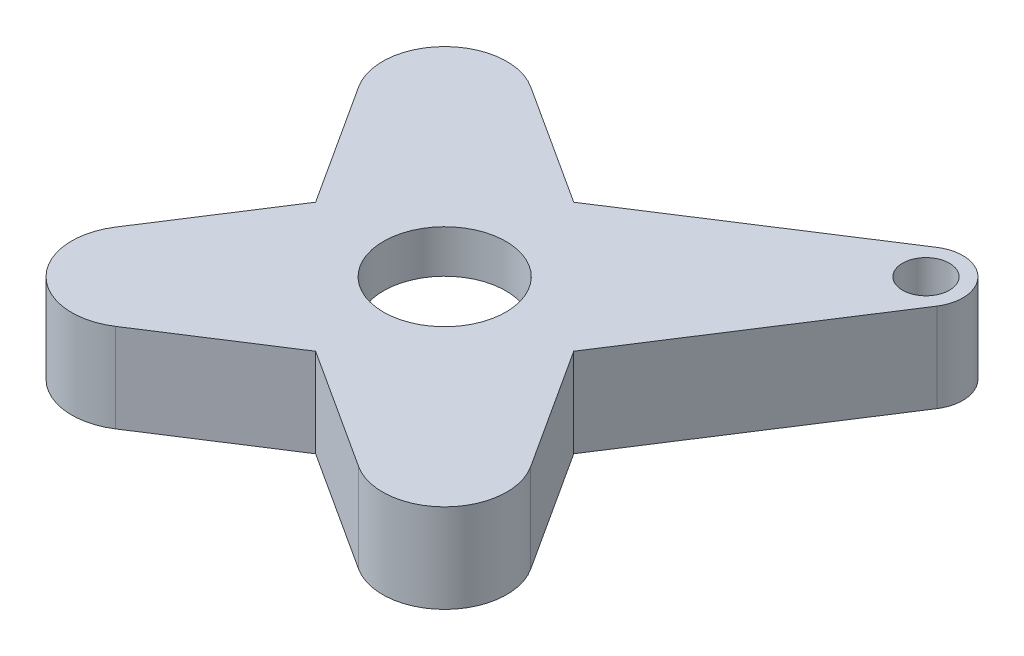
from build123d import *

# Parameters (mm, degrees)
SKETCH1_R           = 4.572
SKETCH1_R_2         = 1.75
BOSS_EXTRUDE1_DEPTH = 3.2004
BOSS_EXTRUDE2_START = -3.429
SKETCH1_3_R         = 1.75
BOSS_EXTRUDE2_DEPTH = 3.429


with BuildPart() as part:
    # Sketch1 → Boss-Extrude1 (new body)
    with BuildSketch(Plane(origin=(0, 0, 0), x_dir=(1, 0, 0), z_dir=(0, 1, 0))):
        with BuildLine():
            Line((15.494618326, -9.079673628), (9.632116129, 0))
            Line((9.632116129, 0), (20.267125172, 16.471194022))
            ThreePointArc((20.267125172, 16.471194022), (19.901971998, 19.901971998), (16.471194022, 20.267125172))
            Line((16.471194022, 20.267125172), (0, 9.632116129))
            Line((0, 9.632116129), (-9.079673628, 15.494618326))
            ThreePointArc((-9.079673628, 15.494618326), (-14.877526676, 14.877526676), (-15.494618326, 9.079673628))
            Line((-15.494618326, 9.079673628), (-9.632116129, 0))
            Line((-9.632116129, 0), (-15.494618326, -9.079673628))
            ThreePointArc((-15.494618326, -9.079673628), (-14.877526676, -14.877526676), (-9.079673628, -15.494618326))
            Line((-9.079673628, -15.494618326), (0, -9.632116129))
            Line((0, -9.632116129), (9.079673628, -15.494618326))
            ThreePointArc((9.079673628, -15.494618326), (14.877526676, -14.877526676), (15.494618326, -9.079673628))
        make_face()
        Circle(SKETCH1_R, mode=Mode.SUBTRACT)
        with Locations((17.960512242, 17.960512242)):
            Circle(SKETCH1_R_2, mode=Mode.SUBTRACT)
    extrude(amount=BOSS_EXTRUDE1_DEPTH)

    # Sketch1<3> → Boss-Extrude2 (add)
    with BuildSketch(Plane(origin=(0, 0, 0), x_dir=(1, 0, 0), z_dir=(0, 1, 0)).offset(BOSS_EXTRUDE2_START)):
        with BuildLine():
            Line((15.494618326, -9.079673628), (9.632116129, 0))
            Line((9.632116129, 0), (20.267125172, 16.471194022))
            ThreePointArc((20.267125172, 16.471194022), (19.901971998, 19.901971998), (16.471194022, 20.267125172))
            Line((16.471194022, 20.267125172), (0, 9.632116129))
            Line((0, 9.632116129), (-9.079673628, 15.494618326))
            ThreePointArc((-9.079673628, 15.494618326), (-14.877526676, 14.877526676), (-15.494618326, 9.079673628))
            Line((-15.494618326, 9.079673628), (-9.632116129, 0))
            Line((-9.632116129, 0), (-15.494618326, -9.079673628))
            ThreePointArc((-15.494618326, -9.079673628), (-14.877526676, -14.877526676), (-9.079673628, -15.494618326))
            Line((-9.079673628, -15.494618326), (0, -9.632116129))
            Line((0, -9.632116129), (9.079673628, -15.494618326))
            ThreePointArc((9.079673628, -15.494618326), (14.877526676, -14.877526676), (15.494618326, -9.079673628))
        make_face()
        with BuildLine():
            Line((13.360762621, 10.457447133), (7.57, 1.488881682))
            ThreePointArc((7.57, 1.488881682), (6.773645479, 0), (7.57, -1.488881682))
            Line((7.57, -1.488881682), (13.360762621, -10.457447133))
            ThreePointArc((13.360762621, -10.457447133), (13.081475452, -13.081475452), (10.457447133, -13.360762621))
            Line((10.457447133, -13.360762621), (1.488881682, -7.57))
            ThreePointArc((1.488881682, -7.57), (0, -6.773645479), (-1.488881682, -7.57))
            Line((-1.488881682, -7.57), (-10.457447133, -13.360762621))
            ThreePointArc((-10.457447133, -13.360762621), (-13.081475452, -13.081475452), (-13.360762621, -10.457447133))
            Line((-13.360762621, -10.457447133), (-7.57, -1.488881682))
            ThreePointArc((-7.57, -1.488881682), (-6.773645479, 0), (-7.57, 1.488881682))
            Line((-7.57, 1.488881682), (-13.360762621, 10.457447133))
            ThreePointArc((-13.360762621, 10.457447133), (-13.081475452, 13.081475452), (-10.457447133, 13.360762621))
            Line((-10.457447133, 13.360762621), (-1.488881682, 7.57))
            ThreePointArc((-1.488881682, 7.57), (0, 6.773645479), (1.488881682, 7.57))
            Line((1.488881682, 7.57), (10.457447133, 13.360762621))
            ThreePointArc((10.457447133, 13.360762621), (13.081475452, 13.081475452), (13.360762621, 10.457447133))
        make_face(mode=Mode.SUBTRACT)
        with Locations((17.960512242, 17.960512242)):
            Circle(SKETCH1_3_R, mode=Mode.SUBTRACT)
    extrude(amount=BOSS_EXTRUDE2_DEPTH)


solid = part.part
